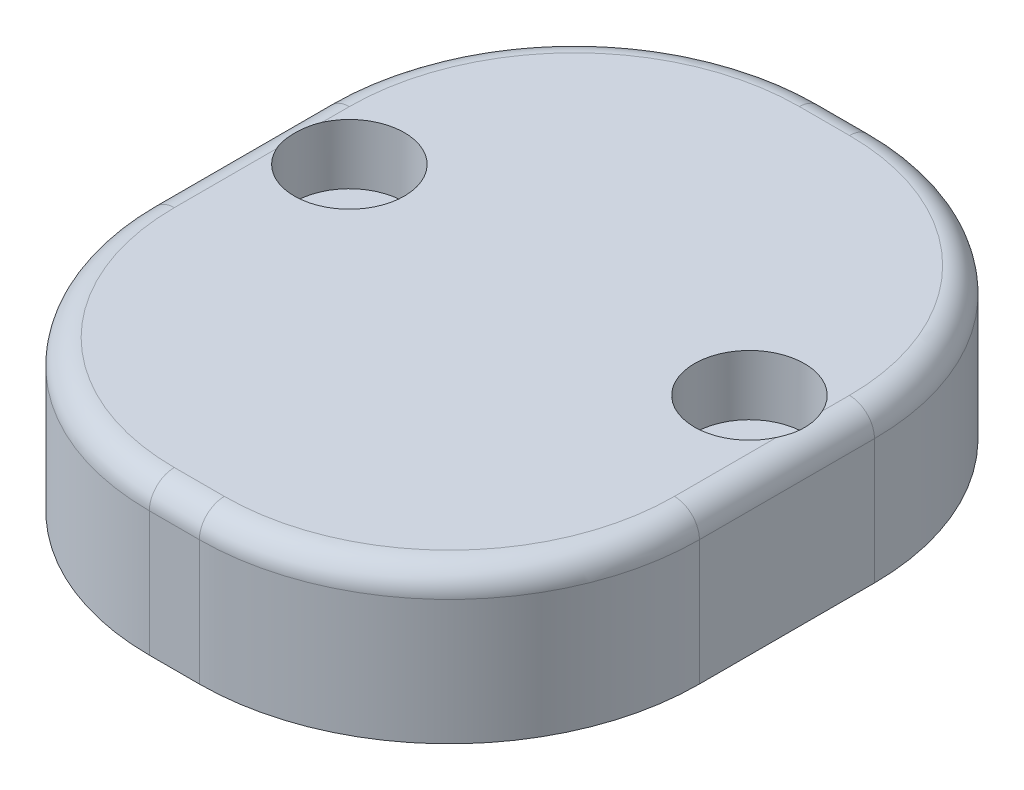
from build123d import *

# Parameters (mm, degrees)
BOSS_EXTRU_1_DEPTH                                 = 22
ESQUISSE2_W                                        = 22
ESQUISSE2_H                                        = 6
BOSS_EXTRU_2_DEPTH                                 = 5
CHAMBRAGE_POUR_VIS_T_TE_HEXAGONALE_M21_D           = 2.4
CHAMBRAGE_POUR_VIS_T_TE_HEXAGONALE_M21_CBORE_D     = 4.4
CHAMBRAGE_POUR_VIS_T_TE_HEXAGONALE_M21_CBORE_DEPTH = 2.4
CONG_1_R                                           = 10
CONG_2_R                                           = 1


with BuildPart() as part:
    # Esquisse1 → Boss.-Extru.1 (new body)
    with BuildSketch(Plane.XY):
        with BuildLine():
            Line((0, 6), (0, 0))
            Line((0, 0), (6, 0))
            ThreePointArc((6, 0), (11, 5), (16, 0))
            Line((16, 0), (22, 0))
            Line((22, 0), (22, 6))
            Line((22, 6), (0, 6))
        make_face()
    extrude(amount=BOSS_EXTRU_1_DEPTH)

    # Esquisse2 → Boss.-Extru.2 (add)
    with BuildSketch(Plane.XY.offset(22)):
        with Locations((11, 3)):
            Rectangle(ESQUISSE2_W, ESQUISSE2_H)
    extrude(amount=BOSS_EXTRU_2_DEPTH)

    # Chambrage pour vis à tête hexagonale M21 (through all)
    with Locations(Plane(origin=(0, 6, 0), x_dir=(1, 0, 0), z_dir=(0, 1, 0))):
        with Locations((19, -12), (3, -12)):
            CounterBoreHole(CHAMBRAGE_POUR_VIS_T_TE_HEXAGONALE_M21_D / 2, CHAMBRAGE_POUR_VIS_T_TE_HEXAGONALE_M21_CBORE_D / 2, CHAMBRAGE_POUR_VIS_T_TE_HEXAGONALE_M21_CBORE_DEPTH)

    # Congé1
    # the kernel refuses this fillet: 10 mm, written as the material it takes off along each edge
    with BuildSketch(Plane(origin=(0, 31, 0), x_dir=(0, 0, 1), z_dir=(0, -1, 0)), Plane(origin=(22, -25, 27), x_dir=(-1, 0, 0), z_dir=(0, 1, 0))) as cong_1_piece_1:
        with BuildLine():
            CenterArc((CONG_1_R, -CONG_1_R), CONG_1_R, 90, 90)
            Line((0, -CONG_1_R), (0, 0))
            Line((0, 0), (CONG_1_R, 0))
        make_face()
    extrude(amount=56, mode=Mode.SUBTRACT)
    with BuildSketch(Plane(origin=(0, 31, 27), x_dir=(0, 0, -1), z_dir=(0, -1, 0)), Plane(origin=(22, -25, 0), x_dir=(-1, 0, 0), z_dir=(0, 1, 0))) as cong_1_piece_2:
        with BuildLine():
            CenterArc((CONG_1_R, CONG_1_R), CONG_1_R, 180, 90)
            Line((0, CONG_1_R), (0, 0))
            Line((0, 0), (CONG_1_R, 0))
        make_face()
    extrude(amount=56, mode=Mode.SUBTRACT)

    # Congé2
    # the kernel refuses this fillet: 1 mm, written as the material it takes off along each edge
    with BuildSketch(Plane(origin=(12, 6, 0), x_dir=(0, 0, 1), z_dir=(-1, 0, 0))) as cong_2_piece_1:
        with BuildLine():
            CenterArc((CONG_2_R, -CONG_2_R), CONG_2_R, 90, 90)
            Line((0, -CONG_2_R), (0, 0))
            Line((0, 0), (CONG_2_R, 0))
        make_face()
    extrude(amount=2, mode=Mode.SUBTRACT)
    with BuildSketch(Plane(origin=(0, 6, 17), x_dir=(0, -1, 0), z_dir=(0, 0, -1)), Plane(origin=(22, 6, 17), x_dir=(-1, 0, 0), z_dir=(0, 0, -1))) as cong_2_piece_2:
        with BuildLine():
            CenterArc((CONG_2_R, -CONG_2_R), CONG_2_R, 90, 90)
            Line((0, -CONG_2_R), (0, 0))
            Line((0, 0), (CONG_2_R, 0))
        make_face()
    extrude(amount=7, mode=Mode.SUBTRACT)
    with BuildSketch(Plane(origin=(12, 6, 27), x_dir=(0, 0, -1), z_dir=(-1, 0, 0))) as cong_2_piece_3:
        with BuildLine():
            CenterArc((CONG_2_R, CONG_2_R), CONG_2_R, 180, 90)
            Line((0, CONG_2_R), (0, 0))
            Line((0, 0), (CONG_2_R, 0))
        make_face()
    extrude(amount=2, mode=Mode.SUBTRACT)
    with BuildSketch(Plane(origin=(12, 6, 17), x_dir=(1, 0, 0), z_dir=(0, 0, -1))) as cong_2_piece_4:
        with BuildLine():
            CenterArc((10 - CONG_2_R, CONG_2_R), CONG_2_R, 270, 90)
            Line((10, CONG_2_R), (10, 0))
            Line((10, 0), (10 - CONG_2_R, 0))
        make_face()
    revolve(axis=Axis((12, 6, 17), (0, -1, 0)), revolution_arc=90, mode=Mode.SUBTRACT)
    with BuildSketch(Plane(origin=(12, 6, 10), x_dir=(0, 0, -1), z_dir=(-1, 0, 0))) as cong_2_piece_5:
        with BuildLine():
            CenterArc((10 - CONG_2_R, CONG_2_R), CONG_2_R, 270, 90)
            Line((10, CONG_2_R), (10, 0))
            Line((10, 0), (10 - CONG_2_R, 0))
        make_face()
    revolve(axis=Axis((12, 6, 10), (0, -1, 0)), revolution_arc=90, mode=Mode.SUBTRACT)
    with BuildSketch(Plane(origin=(10, 6, 17), x_dir=(-1, 0, 0), z_dir=(0, 0, -1))) as cong_2_piece_6:
        with BuildLine():
            CenterArc((10 - CONG_2_R, -CONG_2_R), CONG_2_R, 0, 90)
            Line((10, -CONG_2_R), (10, 0))
            Line((10, 0), (10 - CONG_2_R, 0))
        make_face()
    revolve(axis=Axis((10, 6, 17), (0, 1, 0)), revolution_arc=90, mode=Mode.SUBTRACT)
    with BuildSketch(Plane(origin=(10, 6, 10), x_dir=(0, 0, -1), z_dir=(1, 0, 0))) as cong_2_piece_7:
        with BuildLine():
            CenterArc((10 - CONG_2_R, -CONG_2_R), CONG_2_R, 0, 90)
            Line((10, -CONG_2_R), (10, 0))
            Line((10, 0), (10 - CONG_2_R, 0))
        make_face()
    revolve(axis=Axis((10, 6, 10), (0, 1, 0)), revolution_arc=90, mode=Mode.SUBTRACT)


solid = part.part
